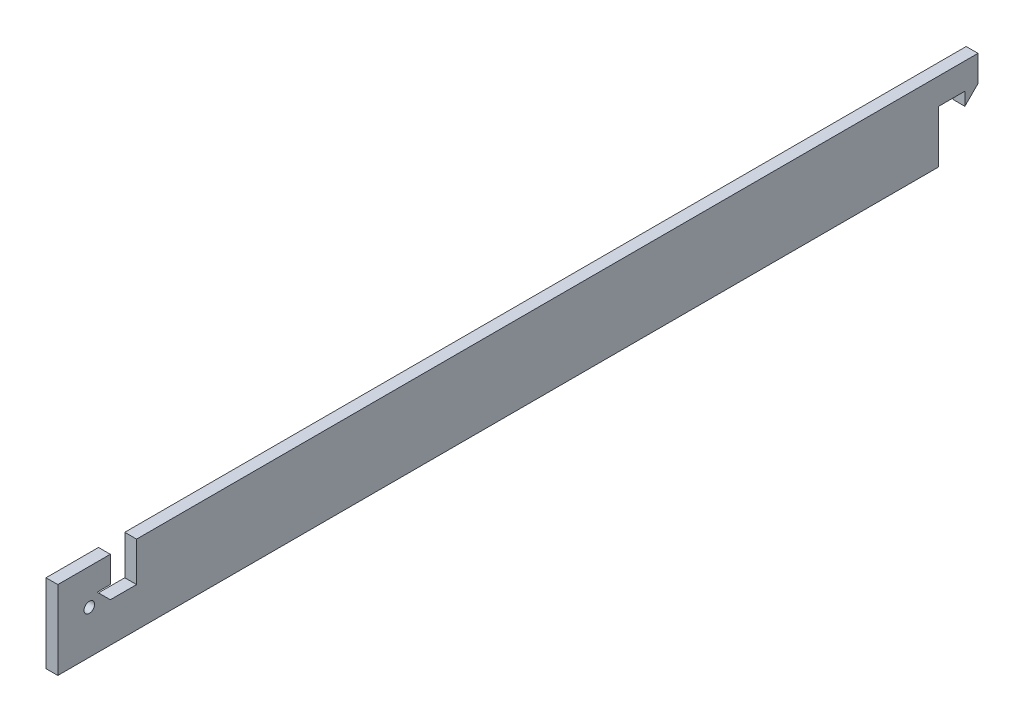
from build123d import *

# Parameters (mm, degrees)
SKETCH1_R           = 2
BOSS_EXTRUDE1_DEPTH = 4.5


with BuildPart() as part:
    # Sketch1 → Boss-Extrude1 (new body)
    with BuildSketch(Plane(origin=(0, 0, 0), x_dir=(0, 0, -1), z_dir=(1, 0, 0))):
        Polygon((-30.84603871, 0), (-40.84603871, 0), (-45.84603871, 5), (-40.84603871, 5), (-40.84603871, 15), (-60.84603871, 15), (-60.84603871, -15), (274.65396129, -15), (274.65396129, 5), (284.65396129, 5), (284.65396129, 0), (289.65396129, 5), (289.65396129, 15), (274.65396129, 15), (-30.84603871, 15), align=None)
        with Locations((-48.84603871, 1.5)):
            Circle(SKETCH1_R, mode=Mode.SUBTRACT)
    extrude(amount=BOSS_EXTRUDE1_DEPTH)


solid = part.part
